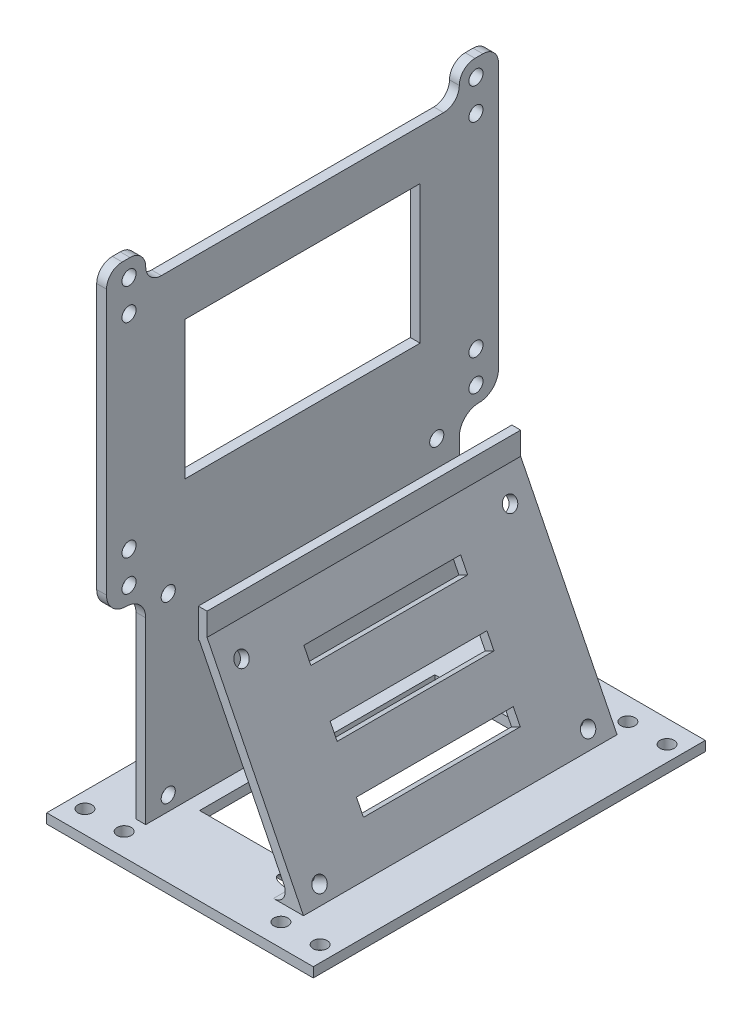
from build123d import *

# Parameters (mm, degrees)
SKETCH_1_W           = 68
SKETCH_1_H           = 100
SKETCH_1_R           = 1.8
EXTRUDE_1_DEPTH      = 2.5
SKETCH_3_W           = 2.5
SKETCH_3_H           = 80
EXTRUDE_2_DEPTH      = 55
SKETCH_4_W           = 30
SKETCH_4_H           = 60
CUT_EXTRUDE_1_DEPTH  = 55
EXTRUDE_3_DEPTH      = 40
EXTRUDE_3_DEPTH_BACK = 40
SKETCH_5_W           = 80
SKETCH_5_H           = 55
EXTRUDE_5_DEPTH      = 2.5
SKETCH_6_R           = 1.8
CUT_EXTRUDE_2_DEPTH  = 2.5
SKETCH_7_R           = 1.8
CUT_EXTRUDE_3_DEPTH  = 2.5
EXTRUDE_START        = 55
SKETCH_8_W           = 2.236067978
SKETCH_8_H           = 80
EXTRUDE_6_DEPTH      = 7.5
SKETCH_10_R          = 1.8
SKETCH_10_W          = 80
SKETCH_10_H          = 3
SKETCH_10_W_2        = 10
SKETCH_10_H_2        = 1.3
SKETCH_10_W_3        = 100
EXTRUDE_7_DEPTH      = 2.5
FILLET_1_R           = 5
FILLET_4_R           = 3
SKETCH_11_R          = 1.8
CUT_EXTRUDE_4_DEPTH  = 30
SKETCH_13_W          = 40
SKETCH_13_H          = 4
CUT_EXTRUDE_5_DEPTH  = 2.5
SKETCH_14_R          = 1.8
CUT_EXTRUDE_6_DEPTH  = 2.5
SKETCH_15_R          = 1.8
EXTRUDE_10_DEPTH     = 2.5
FILLET_6_R           = 4
SKETCH_16_W          = 60
SKETCH_16_H          = 35.254237288
CUT_EXTRUDE_8_DEPTH  = 10


# Some blends are built 0.0001 mm under size
with BuildPart() as part:
    # 草图1 → 凸台-拉伸1 (new body)
    with BuildSketch(Plane(origin=(0, 0, 0), x_dir=(1, 0, 0), z_dir=(0, 1, 0))):
        Rectangle(SKETCH_1_W, SKETCH_1_H)
        with Locations(Location((-30, 44.25, 0), (0, 0, 270))):
            Circle(SKETCH_1_R, mode=Mode.SUBTRACT)
        with Locations(Location((30, 44.25, 0), (0, 0, 270))):
            Circle(SKETCH_1_R, mode=Mode.SUBTRACT)
        with Locations(Location((30, -44.25, 0), (0, 0, 270))):
            Circle(SKETCH_1_R, mode=Mode.SUBTRACT)
        with Locations(Location((-30, -44.25, 0), (0, 0, 270))):
            Circle(SKETCH_1_R, mode=Mode.SUBTRACT)
        with Locations(Location((20, -44.25, 0), (0, 0, 270))):
            Circle(SKETCH_1_R, mode=Mode.SUBTRACT)
        with Locations(Location((20, 44.25, 0), (0, 0, 270))):
            Circle(SKETCH_1_R, mode=Mode.SUBTRACT)
        with Locations(Location((-20, -44.25, 0), (0, 0, 270))):
            Circle(SKETCH_1_R, mode=Mode.SUBTRACT)
        with Locations(Location((-20, 44.25, 0), (0, 0, 270))):
            Circle(SKETCH_1_R, mode=Mode.SUBTRACT)
    extrude(amount=EXTRUDE_1_DEPTH)

    # 草图3 → 凸台-拉伸2 (add)
    with BuildSketch(Plane(origin=(0, 2.5, 0), x_dir=(1, 0, 0), z_dir=(0, 1, 0))):
        with Locations((-20, 0)):
            Rectangle(SKETCH_3_W, SKETCH_3_H)
    extrude(amount=EXTRUDE_2_DEPTH)

    # 草图4 → 切除-拉伸1 (cut)
    with BuildSketch(Plane(origin=(0, 2.5, 0), x_dir=(1, 0, 0), z_dir=(0, 1, 0))):
        Rectangle(SKETCH_4_W, SKETCH_4_H)
    extrude(amount=-CUT_EXTRUDE_1_DEPTH, mode=Mode.SUBTRACT)

    # 草图2 → 凸台-拉伸3 (add, two sides: drawn at the far end of the back side and taken through both)
    with BuildSketch(Plane.XY.offset(-EXTRUDE_3_DEPTH_BACK)):
        Polygon((20, 2.5), (21.5, 2.5), (20, 5.5), align=None)
    extrude(amount=EXTRUDE_3_DEPTH + EXTRUDE_3_DEPTH_BACK)

    # 草图5 → 凸台-拉伸5 (add)
    with BuildSketch(Plane(origin=(18.2, 9.1, 0), x_dir=(0, 0, -1), z_dir=(0.8944271909999156, 0.44721359549995837, 0))):
        with Locations((0, 20.120975674)):
            Rectangle(SKETCH_5_W, SKETCH_5_H)
    extrude(amount=-EXTRUDE_5_DEPTH)

    # 草图6 → 切除-拉伸2 (cut)
    with BuildSketch(Plane.ZY.offset(21.25)):
        with Locations((34.25, 50.7)):
            Circle(SKETCH_6_R)
        with Locations((34.25, 6.2)):
            Circle(SKETCH_6_R)
        with Locations((-34.25, 50.7)):
            Circle(SKETCH_6_R)
        with Locations((-34.25, 6.2)):
            Circle(SKETCH_6_R)
    extrude(amount=-CUT_EXTRUDE_2_DEPTH, mode=Mode.SUBTRACT)

    # 草图7 → 切除-拉伸3 (cut)
    with BuildSketch(Plane(origin=(18.2, 9.1, 0), x_dir=(0, 0, -1), z_dir=(0.8944271909999156, 0.44721359549995837, 0))):
        with Locations(Location((34.25, 40.820975674, 0), (0, 0, 90))):
            Circle(SKETCH_7_R)
        with Locations(Location((-34.25, 40.820975674, 0), (0, 0, 90))):
            Circle(SKETCH_7_R)
        with Locations(Location((-34.25, -3.679024326, 0), (0, 0, 90))):
            Circle(SKETCH_7_R)
        with Locations(Location((34.25, -3.679024326, 0), (0, 0, 90))):
            Circle(SKETCH_7_R)
    extrude(amount=-CUT_EXTRUDE_3_DEPTH, mode=Mode.SUBTRACT)

    # 草图8 → 凸台-拉伸6 (add)
    with BuildSketch(Plane(origin=(0, 2.5, 0), x_dir=(1, 0, 0), z_dir=(0, 1, 0)).offset(EXTRUDE_START)):
        with Locations((-4.214781741, 0)):
            Rectangle(SKETCH_8_W, SKETCH_8_H)
    extrude(amount=-EXTRUDE_6_DEPTH)

    # 草图10 → 凸台-拉伸7 (add)
    # profile 1 of 5: a face of its own
    with BuildSketch(Plane.ZY.offset(21.25)):
        Polygon((50, 120.5), (-50, 120.5), (-50, 54.5), (-40, 54.5), (-40, 57.5), (40, 57.5), (40, 54.5), (50, 54.5), align=None)
        with Locations((-44.25, 57.5)):
            Circle(SKETCH_10_R, mode=Mode.SUBTRACT)
        with Locations((44.25, 57.5)):
            Circle(SKETCH_10_R, mode=Mode.SUBTRACT)
        with Locations((-44.25, 117.5)):
            Circle(SKETCH_10_R, mode=Mode.SUBTRACT)
        with Locations((44.25, 117.5)):
            Circle(SKETCH_10_R, mode=Mode.SUBTRACT)
    # profile 2 of 5: a face of its own
    with BuildSketch(Plane.ZY.offset(21.25)):
        with Locations((0, 56)):
            Rectangle(SKETCH_10_W, SKETCH_10_H)
    # profile 3 of 5: a face of its own
    with BuildSketch(Plane.ZY.offset(21.25)):
        with Locations((-45, 53.85)):
            Rectangle(SKETCH_10_W_2, SKETCH_10_H_2)
    # profile 4 of 5: a face of its own
    with BuildSketch(Plane.ZY.offset(21.25)):
        with Locations((45, 53.85)):
            Rectangle(SKETCH_10_W_2, SKETCH_10_H_2)
    # profile 5 of 5: a face of its own
    with BuildSketch(Plane.ZY.offset(21.25)):
        with Locations((0, 121.15)):
            Rectangle(SKETCH_10_W_3, SKETCH_10_H_2)
    extrude(amount=-EXTRUDE_7_DEPTH)

    # 圆角1
    fillet_1_edges = [part.edges().sort_by_distance(p)[0] for p in [
        (-20, 121.8, -50),
        (-20, 121.8, 50),
        (-20, 53.2, 50),
        (-20, 53.2, -50),
        (-20, 53.2, -40),
        (-20, 53.2, 40),
    ]]
    fillet(fillet_1_edges, radius=FILLET_1_R - 0.0001)  # a hair under: the kernel refuses the full size

    # 圆角4
    # the kernel refuses this fillet: 3 mm, written as the material it adds along each edge
    with BuildSketch(Plane(origin=(18.704915028, 2.5, 40), x_dir=(-1, 0, 0), z_dir=(0, 0, -1))) as fillet_4_piece_1_section:
        with BuildLine():
            CenterArc((FILLET_4_R * 1.61803398875, FILLET_4_R), FILLET_4_R, 153.434948823, 116.565051177)
            Line((FILLET_4_R * 0.72360679775, FILLET_4_R * 1.4472135955), (0, 0))
            Line((0, 0), (FILLET_4_R * 1.61803398875, 0))
        make_face()
    fillet_4_piece_1 = extrude(amount=92.135254916, mode=Mode.PRIVATE)
    fillet_4_piece_1 = split(fillet_4_piece_1, bisect_by=Plane(origin=(14.716283271, 2.568197863, 30), z_dir=(0, 0, 1)), keep=Keep.TOP, mode=Mode.PRIVATE)
    fillet_4_piece_1 = fillet_4_piece_1 - Plane(origin=(14.445615458, 3.109533488, 34.25), x_dir=(-0.44721359549995837, 0.8944271909999156, 0), z_dir=(0.8944271909999156, 0.44721359549995837, 0)) * Cylinder(1.8, 204, mode=Mode.PRIVATE)
    add(fillet_4_piece_1)
    with BuildSketch(Plane(origin=(18.704915028, 2.5, 52.135254916), x_dir=(-1, 0, 0), z_dir=(0, 0, -1))) as fillet_4_piece_2_section:
        with BuildLine():
            CenterArc((FILLET_4_R * 1.61803398875, FILLET_4_R), FILLET_4_R, 153.434948823, 116.565051177)
            Line((FILLET_4_R * 0.72360679775, FILLET_4_R * 1.4472135955), (0, 0))
            Line((0, 0), (FILLET_4_R * 1.61803398875, 0))
        make_face()
    fillet_4_piece_2 = extrude(amount=92.135254916, mode=Mode.PRIVATE)
    fillet_4_piece_2 = split(fillet_4_piece_2, bisect_by=Plane(origin=(17.041037704, 3.56720979, 30), z_dir=(0, 0, -1)), keep=Keep.TOP, mode=Mode.PRIVATE)
    fillet_4_piece_2 = split(fillet_4_piece_2, bisect_by=Plane(origin=(15, 3.56720979, 0), z_dir=(1, 0, 0)), keep=Keep.TOP, mode=Mode.PRIVATE)
    fillet_4_piece_2 = fillet_4_piece_2 - Plane(origin=(16.705023776, 4.239237646, -34.25), x_dir=(-0.44721359549995837, 0.8944271909999156, 0), z_dir=(0.8944271909999156, 0.44721359549995837, 0)) * Cylinder(1.8, 204, mode=Mode.PRIVATE)
    add(fillet_4_piece_2)
    with BuildSketch(Plane(origin=(18.704915028, 2.5, 52.135254916), x_dir=(-1, 0, 0), z_dir=(0, 0, -1))) as fillet_4_piece_3_section:
        with BuildLine():
            CenterArc((FILLET_4_R * 1.61803398875, FILLET_4_R), FILLET_4_R, 153.434948823, 116.565051177)
            Line((FILLET_4_R * 0.72360679775, FILLET_4_R * 1.4472135955), (0, 0))
            Line((0, 0), (FILLET_4_R * 1.61803398875, 0))
        make_face()
    fillet_4_piece_3 = extrude(amount=92.135254916, mode=Mode.PRIVATE)
    fillet_4_piece_3 = split(fillet_4_piece_3, bisect_by=Plane(origin=(14.716283305, 2.568197867, -30), z_dir=(0, 0, -1)), keep=Keep.TOP, mode=Mode.PRIVATE)
    fillet_4_piece_3 = fillet_4_piece_3 - Plane(origin=(14.445615487, 3.109533502, -34.25), x_dir=(-0.44721359549995837, 0.8944271909999156, 0), z_dir=(0.8944271909999156, 0.44721359549995837, 0)) * Cylinder(1.8, 204, mode=Mode.PRIVATE)
    add(fillet_4_piece_3)

    # 草图11 → 切除-拉伸4 (cut)
    with BuildSketch(Plane(origin=(18.2, 9.1, 0), x_dir=(0, 0, -1), z_dir=(0.8944271909999156, 0.44721359549995837, 0))):
        with Locations(Location((-34.25, -3.679024326, 0), (0, 0, 90))):
            Circle(SKETCH_11_R)
        with Locations(Location((34.25, -3.679024326, 0), (0, 0, 90))):
            Circle(SKETCH_11_R)
    extrude(amount=-CUT_EXTRUDE_4_DEPTH, mode=Mode.SUBTRACT)

    # 草图13 → 切除-拉伸5 (cut)
    with BuildSketch(Plane(origin=(18.2, 9.1, 0), x_dir=(0, 0, -1), z_dir=(0.8944271909999156, 0.44721359549995837, 0))):
        with Locations((0, 20.120975674)):
            Rectangle(SKETCH_13_W, SKETCH_13_H)
        with Locations((0, 35.120975674)):
            Rectangle(SKETCH_13_W, SKETCH_13_H)
        with Locations((0, 5.120975674)):
            Rectangle(SKETCH_13_W, SKETCH_13_H)
    extrude(amount=-CUT_EXTRUDE_5_DEPTH, mode=Mode.SUBTRACT)

    # 草图14 → 切除-拉伸6 (cut)
    with BuildSketch(Plane.ZY.offset(21.25)):
        with Locations((-44.25, 65.5)):
            Circle(SKETCH_14_R)
        with Locations((44.25, 65.5)):
            Circle(SKETCH_14_R)
    extrude(amount=-CUT_EXTRUDE_6_DEPTH, mode=Mode.SUBTRACT)

    # 草图15 → 凸台-拉伸10 (add)
    # profile 1 of 4: a face of its own
    with BuildSketch(Plane.ZY.offset(21.25)):
        Polygon((-42.960162103, 121.8), (-40, 121.8), (-40, 129.8), (-50, 129.8), (-50, 121.8), (-45, 121.8), align=None)
        with Locations((-44.25, 125.5)):
            Circle(SKETCH_15_R, mode=Mode.SUBTRACT)
    # profile 2 of 4: a face of its own
    with BuildSketch(Plane.ZY.offset(21.25)):
        Polygon((40, 129.8), (40, 121.8), (44.25, 121.8), (45, 121.8), (50, 121.8), (50, 129.8), align=None)
        with Locations((44.25, 125.5)):
            Circle(SKETCH_15_R, mode=Mode.SUBTRACT)
    # profile 3 of 4: a face of its own
    with BuildSketch(Plane.ZY.offset(21.25)):
        Polygon((-50, 114.760162103), (-42.960162103, 121.8), (-45, 121.8), (-50, 121.8), align=None)
    # profile 4 of 4: a face of its own
    with BuildSketch(Plane.ZY.offset(21.25)):
        Polygon((45, 121.8), (44.25, 121.8), (50, 115.456159587), (50, 121.8), align=None)
    extrude(amount=-EXTRUDE_10_DEPTH)

    # 圆角6
    fillet_6_edges = [part.edges().sort_by_distance(p)[0] for p in [
        (-20, 121.8, 40),
        (-20, 129.8, 40),
        (-20, 129.8, 50),
        (-20, 129.8, -50),
        (-20, 129.8, -40),
        (-20, 121.8, -40),
    ]]
    fillet(fillet_6_edges, radius=FILLET_6_R - 0.0001)  # a hair under: the kernel refuses the full size

    # 草图16 → 切除-拉伸8 (cut)
    with BuildSketch(Plane.ZY.offset(21.25)):
        with Locations((0, 91.5)):
            Rectangle(SKETCH_16_W, SKETCH_16_H)
    extrude(amount=-CUT_EXTRUDE_8_DEPTH, mode=Mode.SUBTRACT)


solid = part.part
